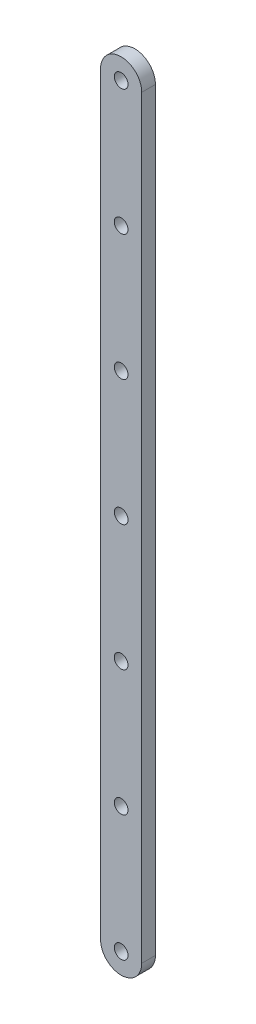
from build123d import *

# Parameters (mm, degrees)
SKETCH2_R           = 5
BOSS_EXTRUDE1_DEPTH = 10


with BuildPart() as part:
    # Sketch2 → Boss-Extrude1 (new body)
    with BuildSketch(Plane(origin=(0, 0, 0), x_dir=(0, 1, 0), z_dir=(0, 0, 1))):
        with BuildLine():
            Line((-275, 15), (275, 15))
            ThreePointArc((275, 15), (290, 0), (275, -15))
            Line((275, -15), (-275, -15))
            ThreePointArc((-275, -15), (-290, 0), (-275, 15))
        make_face()
        with Locations((-275, 0)):
            Circle(SKETCH2_R, mode=Mode.SUBTRACT)
        with Locations((-183.333333333, 0)):
            Circle(SKETCH2_R, mode=Mode.SUBTRACT)
        with Locations((-91.666666667, 0)):
            Circle(SKETCH2_R, mode=Mode.SUBTRACT)
        Circle(SKETCH2_R, mode=Mode.SUBTRACT)
        with Locations((91.666666667, 0)):
            Circle(SKETCH2_R, mode=Mode.SUBTRACT)
        with Locations((183.333333333, 0)):
            Circle(SKETCH2_R, mode=Mode.SUBTRACT)
        with Locations((275, 0)):
            Circle(SKETCH2_R, mode=Mode.SUBTRACT)
    extrude(amount=BOSS_EXTRUDE1_DEPTH)


solid = part.part
